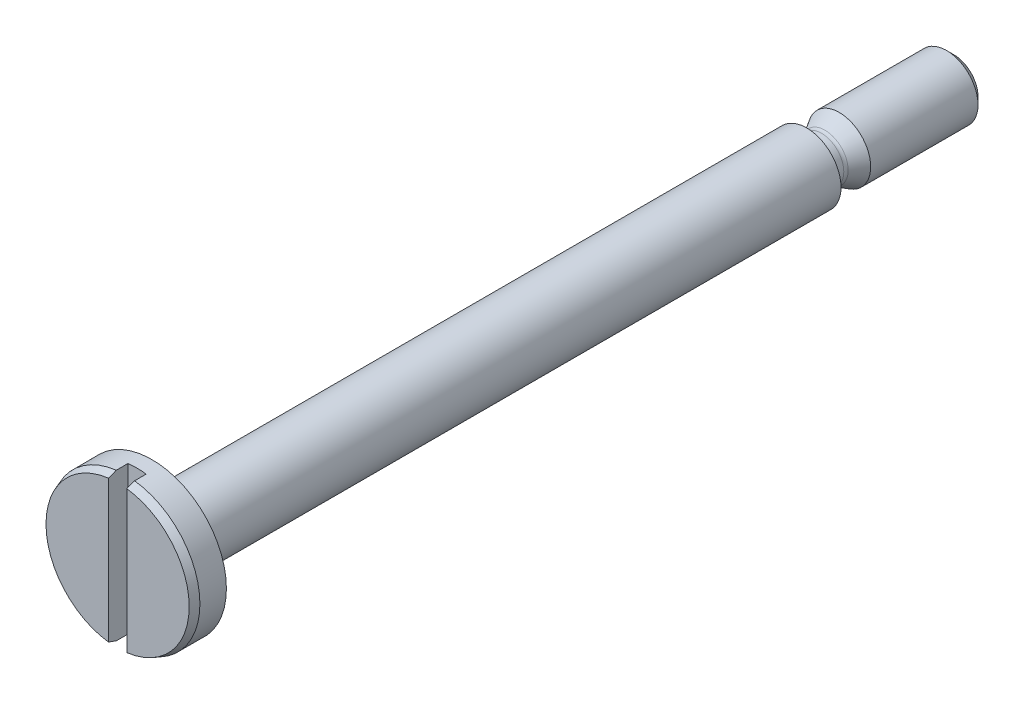
from build123d import *

# Parameters (mm, degrees)
CROQUIS2_R              = 6.5
SALIENTE_EXTRUIR1_DEPTH = 3
CROQUIS3_R              = 3
SALIENTE_EXTRUIR2_DEPTH = 70
CROQUIS4_OUTSIDE_W      = 32.968
CROQUIS4_OUTSIDE_H      = 32.968
CROQUIS4_OUTSIDE_R      = 6.25
CORTAR_EXTRUIR1_DEPTH   = 4
CORTAR_EXTRUIR1_DRAFT   = -20
CROQUIS6_W              = 1.6
CROQUIS6_H              = 14.093492938
CORTAR_EXTRUIR2_DEPTH   = 1.7


# Read off the part's stored shape, not the designer's step: #12-24 Machine Threads Stud1
with BuildPart() as part:
    # Croquis2 → Saliente-Extruir1 (new body)
    with BuildSketch(Plane.XY):
        Circle(CROQUIS2_R)
    extrude(amount=SALIENTE_EXTRUIR1_DEPTH)

    # Croquis3 → Saliente-Extruir2 (add)
    with BuildSketch(Plane(origin=(0, 0, 0), x_dir=(-1, 0, 0), z_dir=(0, 0, -1))):
        Circle(CROQUIS3_R)
    extrude(amount=SALIENTE_EXTRUIR2_DEPTH)


with BuildPart() as cortar_extruir1_tool:
    # Croquis4 outside → Cortar-Extruir1 (with draft: the straight prism first)
    with BuildSketch(Plane.XY.offset(3)):
        Rectangle(CROQUIS4_OUTSIDE_W, CROQUIS4_OUTSIDE_H)
        Circle(CROQUIS4_OUTSIDE_R, mode=Mode.SUBTRACT)
    extrude(amount=-CORTAR_EXTRUIR1_DEPTH)
    # Cortar-Extruir1: the draft: its side faces are tilted about the plane it starts from
    cortar_extruir1_sides = [cortar_extruir1_tool.faces().sort_by_distance(p)[0] for p in [
        (0, -16.484, 1),
        (16.484, 0, 1),
        (0, 16.484, 1),
        (-16.484, 0, 1),
        (-6.25, 0, 1),
    ]]
    draft(cortar_extruir1_sides, Plane.XY.offset(3), CORTAR_EXTRUIR1_DRAFT)


with BuildPart() as part_1:
    add(part.part)

    # Cortar-Extruir1: cut by cortar_extruir1_tool
    add(cortar_extruir1_tool.part, mode=Mode.SUBTRACT)

    # Croquis6 → Cortar-Extruir2 (cut)
    with BuildSketch(Plane.XY.offset(3)):
        Rectangle(CROQUIS6_W, CROQUIS6_H)
    extrude(amount=-CORTAR_EXTRUIR2_DEPTH, mode=Mode.SUBTRACT)

    # #12-24 Machine Threads Stud1 outline → #12-24 Machine Threads Stud1 (revolve, cut)
    with BuildSketch(Plane.XZ):
        with BuildLine():
            Line((2.11328, -70), (3, -70))
            Line((3, -70), (3, -57.153588301))
            Line((3, -57.153588301), (2.543199892, -57.153588301))
            ThreePointArc((2.543199892, -57.153588301), (2.118935595, -57.329324327), (1.943199568, -57.753588625))
            Line((1.943199568, -57.753588625), (1.943199568, -58.453589003))
            ThreePointArc((1.943199568, -58.453589003), (1.963644083, -58.608880514), (2.023584369, -58.753589165))
            Line((2.023584369, -58.753589165), (2.7432, -60))
            Line((2.7432, -60), (2.7432, -69.37008))
            Line((2.7432, -69.37008), (2.11328, -70))
        make_face()
    revolve(axis=Axis((0, 0, 0), (0, 0, 1)), mode=Mode.SUBTRACT)


solid = part_1.part
